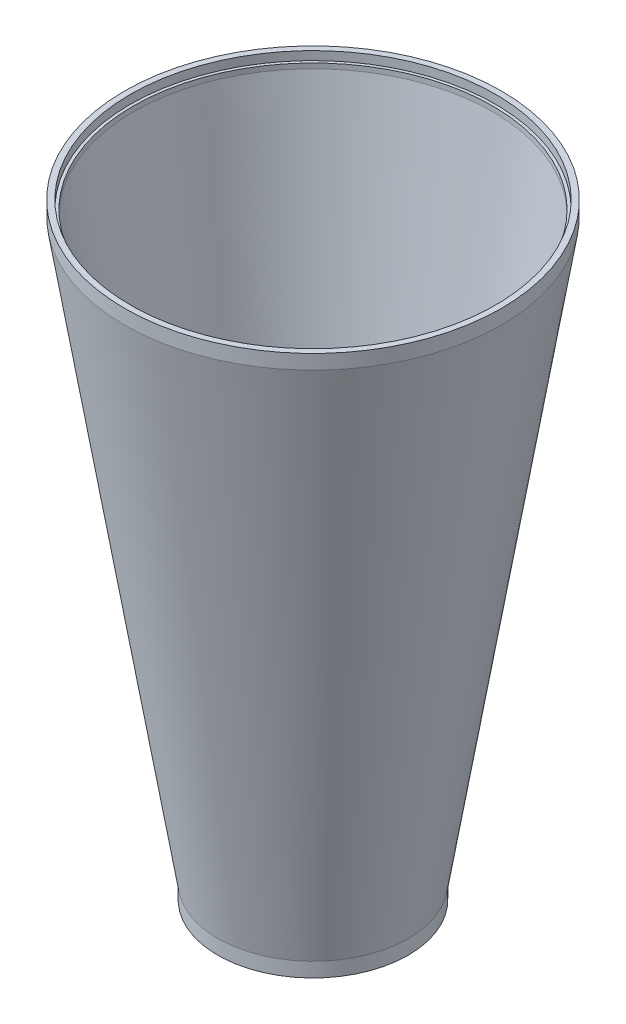
from build123d import *

# Parameters (mm, degrees)
SKETCH_3_R          = 65.2
EXTRUDE_2_DEPTH     = 5
SHELL_1_T           = -3
CUT_EXTRUDE_START   = -3
SKETCH_4_R          = 63.2
SKETCH_4_R_2        = 62.2
CUT_EXTRUDE_3_DEPTH = 3
SKETCH_7_R          = 31
SKETCH_7_R_2        = 30
CUT_EXTRUDE_6_DEPTH = 3


with BuildPart() as part:
    # 스케치1 → 회전1 (revolve)
    with BuildSketch(Plane.XY):
        Polygon((0, 0), (65.2, 0), (33, -200), (33, -205), (0, -205), align=None)
    revolve(axis=Axis((0, -205, 0), (0, 1, 0)))

    # 스케치3 → 보스-돌출2 (add)
    with BuildSketch(Plane(origin=(0, 0, 0), x_dir=(1, 0, 0), z_dir=(0, 1, 0))):
        Circle(SKETCH_3_R)
    extrude(amount=EXTRUDE_2_DEPTH)

    # 쉘1
    shell_1_openings = [part.faces().sort_by_distance(p)[0] for p in [
        (0, -205, 0),
        (0, 5, 0),
    ]]
    offset(amount=SHELL_1_T, openings=shell_1_openings, kind=Kind.INTERSECTION)

    # 스케치4 → 컷-돌출3 (cut)
    with BuildSketch(Plane(origin=(0, 5, 0), x_dir=(1, 0, 0), z_dir=(0, 1, 0)).offset(CUT_EXTRUDE_START)):
        Circle(SKETCH_4_R)
        Circle(SKETCH_4_R_2, mode=Mode.SUBTRACT)
    extrude(amount=CUT_EXTRUDE_3_DEPTH, mode=Mode.SUBTRACT)

    # 스케치7 → 컷-돌출6 (cut)
    with BuildSketch(Plane.XZ.offset(205)):
        Circle(SKETCH_7_R)
        Circle(SKETCH_7_R_2, mode=Mode.SUBTRACT)
    extrude(amount=-CUT_EXTRUDE_6_DEPTH, mode=Mode.SUBTRACT)


solid = part.part
